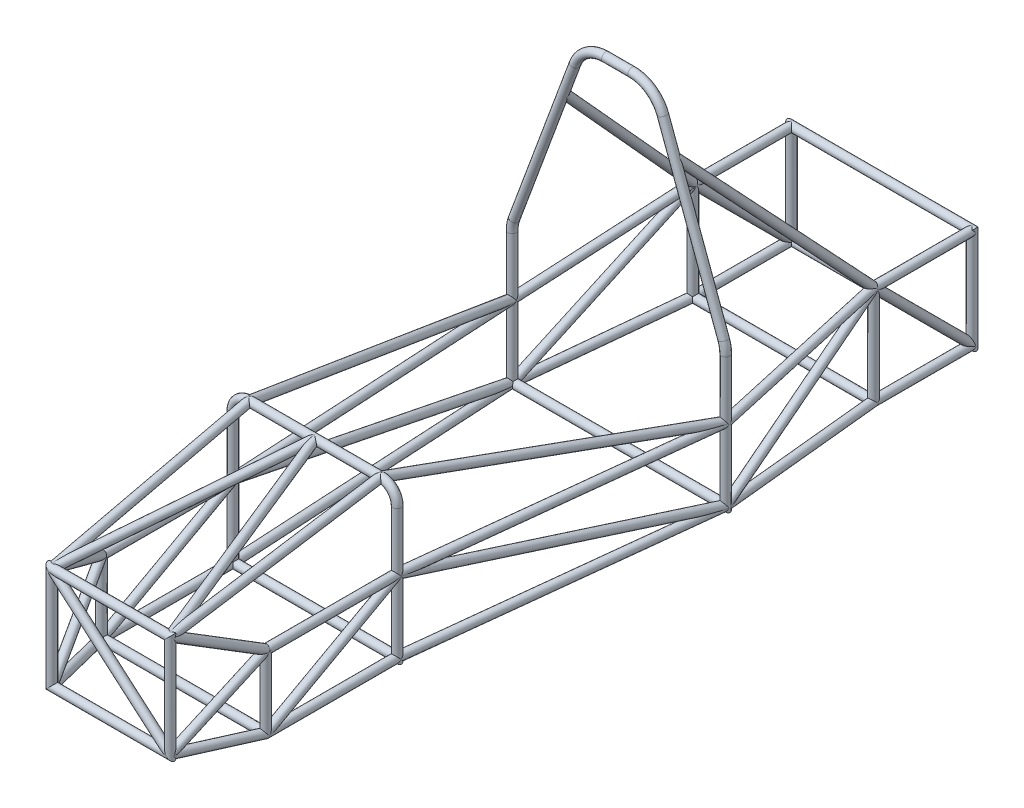
from build123d import *

# Parameters (mm, degrees)
SKETCH13_R                             = 12.7
SKETCH13_R_2                           = 10.3
PIPE_MAIN_HOOP_1_DEPTH                 = 418.960512242
SKETCH13_ON_SEGMENT_2_R                = 12.7
SKETCH13_ON_SEGMENT_2_R_2              = 10.3
PIPE_MAIN_HOOP_1_2_DEPTH               = 687.921024484
SKETCH13_ON_SEGMENT_3_R                = 12.7
SKETCH13_ON_SEGMENT_3_R_2              = 10.3
PIPE_MAIN_HOOP_1_3_DEPTH               = 418.960512242
SKETCH13_ON_SEGMENT_4_R                = 12.7
SKETCH13_ON_SEGMENT_4_R_2              = 10.3
PIPE_MAIN_HOOP_1_4_ANGLE               = 20.30447371
SKETCH13_ON_SEGMENT_5_R                = 12.7
SKETCH13_ON_SEGMENT_5_R_2              = 10.3
PIPE_MAIN_HOOP_1_5_DEPTH               = 533.127564472
SKETCH13_ON_SEGMENT_6_R                = 12.7
SKETCH13_ON_SEGMENT_6_R_2              = 10.3
PIPE_MAIN_HOOP_1_6_ANGLE               = 69.69552629
SKETCH13_ON_SEGMENT_7_R                = 12.7
SKETCH13_ON_SEGMENT_7_R_2              = 10.3
PIPE_MAIN_HOOP_1_7_DEPTH               = 80
SKETCH13_ON_SEGMENT_8_R                = 12.7
SKETCH13_ON_SEGMENT_8_R_2              = 10.3
PIPE_MAIN_HOOP_1_8_ANGLE               = 69.69552629
SKETCH13_ON_SEGMENT_9_R                = 12.7
SKETCH13_ON_SEGMENT_9_R_2              = 10.3
PIPE_MAIN_HOOP_1_9_DEPTH               = 533.127564472
SKETCH13_ON_SEGMENT_10_R               = 12.7
SKETCH13_ON_SEGMENT_10_R_2             = 10.3
PIPE_MAIN_HOOP_1_10_ANGLE              = 20.30447371
PIPE_MAIN_HOOP_2_DEPTH                 = 400
PIPE_MAIN_HOOP_2_DEPTH_BACK            = 18.960512242
SKETCH14_R                             = 12.7
SKETCH14_R_2                           = 10.3
SKETCH14_ON_SEGMENT_2_R                = 12.7
SKETCH14_ON_SEGMENT_2_R_2              = 10.3
PIPE_MAIN_HOOP_2_2_ANGLE               = 90
SKETCH14_ON_SEGMENT_3_R                = 12.7
SKETCH14_ON_SEGMENT_3_R_2              = 10.3
PIPE_MAIN_HOOP_2_3_DEPTH               = 400
SKETCH14_ON_SEGMENT_4_R                = 12.7
SKETCH14_ON_SEGMENT_4_R_2              = 10.3
PIPE_MAIN_HOOP_2_4_ANGLE               = 90
SKETCH14_ON_SEGMENT_5_R                = 12.7
SKETCH14_ON_SEGMENT_5_R_2              = 10.3
PIPE_MAIN_HOOP_2_5_DEPTH               = 418.960512242
SKETCH14_ON_SEGMENT_6_R                = 12.7
SKETCH14_ON_SEGMENT_6_R_2              = 10.3
PIPE_MAIN_HOOP_2_6_DEPTH               = 537.921024484
PIPE_SECONDARY_PROFILE_1_DEPTH         = 328.960512242
PIPE_SECONDARY_PROFILE_1_DEPTH_BACK    = 18.960512242
SKETCH16_R                             = 12.7
SKETCH16_R_2                           = 11.05
SKETCH16_ON_SEGMENT_2_R                = 12.7
SKETCH16_ON_SEGMENT_2_R_2              = 11.05
PIPE_SECONDARY_PROFILE_1_2_DEPTH       = 397.921024484
SKETCH16_ON_SEGMENT_3_R                = 12.7
SKETCH16_ON_SEGMENT_3_R_2              = 11.05
PIPE_SECONDARY_PROFILE_1_3_DEPTH       = 347.921024484
SKETCH16_ON_SEGMENT_4_R                = 12.7
SKETCH16_ON_SEGMENT_4_R_2              = 11.05
PIPE_SECONDARY_PROFILE_1_4_DEPTH       = 397.921024484
SKETCH17_R                             = 12.7
SKETCH17_R_2                           = 11.05
PIPE_SECONDARY_PROFILE_2_DEPTH         = 905.538513814
SKETCH17_ON_SEGMENT_2_R                = 12.7
SKETCH17_ON_SEGMENT_2_R_2              = 11.05
PIPE_SECONDARY_PROFILE_2_2_DEPTH       = 905.538513814
SKETCH18_R                             = 12.7
SKETCH18_R_2                           = 11.05
PIPE_SECONDARY_PROFILE_3_DEPTH         = 931.879820578
SKETCH19_R                             = 12.7
SKETCH19_R_2                           = 11.05
PIPE_SECONDARY_PROFILE_4_DEPTH         = 901.387818866
SKETCH19_ON_SEGMENT_2_R                = 12.7
SKETCH19_ON_SEGMENT_2_R_2              = 11.05
PIPE_SECONDARY_PROFILE_4_2_DEPTH       = 901.387818866
SKETCH110_R                            = 12.7
SKETCH110_R_2                          = 11.05
PIPE_SECONDARY_PROFILE_5_DEPTH         = 927.846970141
SKETCH112_R                            = 12.7
SKETCH112_R_2                          = 11.5
PIPE_TERTIARY_PROFILE_1_DEPTH          = 688.812020801
SKETCH112_ON_SEGMENT_2_R               = 12.7
SKETCH112_ON_SEGMENT_2_R_2             = 11.5
PIPE_TERTIARY_PROFILE_1_2_DEPTH        = 673.484966425
SKETCH114_R                            = 12.7
SKETCH114_R_2                          = 11.05
PIPE_SECONDARY_PROFILE_6_DEPTH         = 661.275109532
SKETCH114_ON_SEGMENT_2_R               = 12.7
SKETCH114_ON_SEGMENT_2_R_2             = 11.05
PIPE_SECONDARY_PROFILE_6_2_DEPTH       = 945.831277028
SKETCH115_R                            = 12.7
SKETCH115_R_2                          = 11.05
PIPE_SECONDARY_PROFILE_7_DEPTH         = 662.70396213
SKETCH115_ON_SEGMENT_2_R               = 12.7
SKETCH115_ON_SEGMENT_2_R_2             = 11.05
PIPE_SECONDARY_PROFILE_7_2_DEPTH       = 938.829504651
SKETCH116_R                            = 12.7
SKETCH116_R_2                          = 11.05
PIPE_SECONDARY_PROFILE_8_DEPTH         = 261.29359767
SKETCH116_ON_SEGMENT_2_R               = 12.7
SKETCH116_ON_SEGMENT_2_R_2             = 11.05
PIPE_SECONDARY_PROFILE_8_2_DEPTH       = 403.258716307
SKETCH117_ON_SEGMENT_1_R               = 12.7
SKETCH117_ON_SEGMENT_1_R_2             = 11.05
PIPE_SECONDARY_PROFILE_10_DEPTH        = 404.791138609
PIPE_SECONDARY_PROFILE_10_2_DEPTH      = 273.316666159
PIPE_SECONDARY_PROFILE_10_2_DEPTH_BACK = 4.791138609
SKETCH117_R                            = 12.7
SKETCH117_R_2                          = 11.05
SKETCH118_R                            = 12.7
SKETCH118_R_2                          = 11.05
PIPE_SECONDARY_PROFILE_11_DEPTH        = 325.89727493
SKETCH118_ON_SEGMENT_2_R               = 12.7
SKETCH118_ON_SEGMENT_2_R_2             = 11.05
PIPE_SECONDARY_PROFILE_11_2_DEPTH      = 407.24072
SKETCH119_ON_SEGMENT_1_R               = 12.7
SKETCH119_ON_SEGMENT_1_R_2             = 11.05
PIPE_SECONDARY_PROFILE_12_DEPTH        = 406.683960994
PIPE_SECONDARY_PROFILE_12_2_DEPTH      = 305.650126779
PIPE_SECONDARY_PROFILE_12_2_DEPTH_BACK = 6.683960994
SKETCH119_R                            = 12.7
SKETCH119_R_2                          = 11.05
SKETCH121_R                            = 12.7
SKETCH121_R_2                          = 11.5
PIPE_TERTIARY_PROFILE_3_DEPTH          = 475.078940809
SKETCH124_R                            = 12.7
SKETCH124_R_2                          = 11.05
PIPE_SECONDARY_PROFILE_14_DEPTH        = 500
SKETCH126_R                            = 12.7
SKETCH126_R_2                          = 11.5
PIPE_TERTIARY_PROFILE_4_DEPTH          = 456.508488421
SKETCH127_R                            = 12.7
SKETCH127_R_2                          = 11.5
PIPE_TERTIARY_PROFILE_5_DEPTH          = 456.508488421
SKETCH129_R                            = 12.7
SKETCH129_R_2                          = 11.05
PIPE_SECONDARY_PROFILE_15_DEPTH        = 231.933823609
SKETCH129_ON_SEGMENT_2_R               = 12.7
SKETCH129_ON_SEGMENT_2_R_2             = 11.05
PIPE_SECONDARY_PROFILE_15_2_DEPTH      = 314.625085458
SKETCH130_R                            = 12.7
SKETCH130_R_2                          = 11.05
PIPE_SECONDARY_PROFILE_16_DEPTH        = 231.63191628
SKETCH130_ON_SEGMENT_2_R               = 12.7
SKETCH130_ON_SEGMENT_2_R_2             = 11.05
PIPE_SECONDARY_PROFILE_16_2_DEPTH      = 300.599042438
PIPE_SECONDARY_PROFILE_20_DEPTH        = 568.960512242
PIPE_SECONDARY_PROFILE_20_DEPTH_BACK   = 18.960512242
SKETCH135_R                            = 12.7
SKETCH135_R_2                          = 11.05
SKETCH135_ON_SEGMENT_2_R               = 12.7
SKETCH135_ON_SEGMENT_2_R_2             = 11.05
PIPE_SECONDARY_PROFILE_20_2_DEPTH      = 337.921024484
SKETCH135_ON_SEGMENT_3_R               = 12.7
SKETCH135_ON_SEGMENT_3_R_2             = 11.05
PIPE_SECONDARY_PROFILE_20_3_DEPTH      = 587.921024484
SKETCH135_ON_SEGMENT_4_R               = 12.7
SKETCH135_ON_SEGMENT_4_R_2             = 11.05
PIPE_SECONDARY_PROFILE_20_4_DEPTH      = 337.921024484
SKETCH136_ON_SEGMENT_1_R               = 12.7
SKETCH136_ON_SEGMENT_1_R_2             = 11.05
PIPE_SECONDARY_PROFILE_21_DEPTH        = 301.895791704
PIPE_SECONDARY_PROFILE_21_2_DEPTH      = 502.493781056
PIPE_SECONDARY_PROFILE_21_2_DEPTH_BACK = 1.895791704
SKETCH136_R                            = 12.7
SKETCH136_R_2                          = 11.05
SKETCH137_R                            = 12.7
SKETCH137_R_2                          = 11.05
PIPE_SECONDARY_PROFILE_22_DEPTH        = 504.38957276
SKETCH137_ON_SEGMENT_2_R               = 12.7
SKETCH137_ON_SEGMENT_2_R_2             = 11.05
PIPE_SECONDARY_PROFILE_22_2_DEPTH      = 301.895791704
SKETCH138_R                            = 12.7
SKETCH138_R_2                          = 11.05
PIPE_SECONDARY_PROFILE_23_DEPTH        = 511.50174318
SKETCH138_ON_SEGMENT_2_R               = 12.7
SKETCH138_ON_SEGMENT_2_R_2             = 11.05
PIPE_SECONDARY_PROFILE_23_2_DEPTH      = 302.679573851
SKETCH139_R                            = 12.7
SKETCH139_R_2                          = 11.05
PIPE_SECONDARY_PROFILE_24_DEPTH        = 511.50174318
SKETCH139_ON_SEGMENT_2_R               = 12.7
SKETCH139_ON_SEGMENT_2_R_2             = 11.05
PIPE_SECONDARY_PROFILE_24_2_DEPTH      = 302.679573851
SKETCH140_R                            = 12.7
SKETCH140_R_2                          = 11.05
PIPE_SECONDARY_PROFILE_25_DEPTH        = 300
SKETCH141_R                            = 12.7
SKETCH141_R_2                          = 11.05
PIPE_SECONDARY_PROFILE_26_DEPTH        = 300
SKETCH142_R                            = 12.7
SKETCH142_R_2                          = 11.05
PIPE_SECONDARY_PROFILE_27_DEPTH        = 743.554316585
SKETCH143_R                            = 12.7
SKETCH143_R_2                          = 11.05
PIPE_SECONDARY_PROFILE_28_DEPTH        = 743.554316585
SKETCH144_R                            = 12.7
SKETCH144_R_2                          = 11.05
PIPE_SECONDARY_PROFILE_29_DEPTH        = 550
SKETCH145_R                            = 12.7
SKETCH145_R_2                          = 11.05
PIPE_SECONDARY_PROFILE_30_DEPTH        = 424.264068712
SKETCH146_R                            = 12.7
SKETCH146_R_2                          = 11.05
PIPE_SECONDARY_PROFILE_31_DEPTH        = 585.234995536
SKETCH147_R                            = 12.7
SKETCH147_R_2                          = 11.05
PIPE_SECONDARY_PROFILE_32_DEPTH        = 424.264068712
SKETCH148_R                            = 12.7
SKETCH148_R_2                          = 11.05
PIPE_SECONDARY_PROFILE_33_DEPTH        = 585.234995536


with BuildPart() as part:
    # Sketch13 → Pipe MAIN HOOP(1) (new body)
    with BuildSketch(Plane(origin=(650, 400, 0), x_dir=(1, 0, 0), z_dir=(0, -1, 0))):
        Circle(SKETCH13_R)
        Circle(SKETCH13_R_2, mode=Mode.SUBTRACT)
    extrude(amount=PIPE_MAIN_HOOP_1_DEPTH)

    # Pipe MAIN HOOP(1) mitre 1
    split(bisect_by=Plane(origin=(650, 0, 0), x_dir=(-0.707106781, 0.707106781, 0), z_dir=(0.707106781, 0.707106781, 0)), keep=Keep.TOP)


with BuildPart() as body_2:
    # Sketch13 on segment 2 (carried to segment 2) → Pipe MAIN HOOP_1 2 (new body)
    with BuildSketch(Plane(origin=(668.960512242, 0, 0), x_dir=(0, -1, 0), z_dir=(-1, 0, 0))):
        Circle(SKETCH13_ON_SEGMENT_2_R)
        Circle(SKETCH13_ON_SEGMENT_2_R_2, mode=Mode.SUBTRACT)
    extrude(amount=PIPE_MAIN_HOOP_1_2_DEPTH)

    # Pipe MAIN HOOP_1 2 mitre 1
    split(bisect_by=Plane(origin=(650, 0, 0), x_dir=(0.707106781, -0.707106781, 0), z_dir=(-0.707106781, -0.707106781, 0)), keep=Keep.TOP)

    # Pipe MAIN HOOP_1 2 mitre 2
    split(bisect_by=Plane(origin=(0, 0, 0), x_dir=(0.707106781, 0.707106781, 0), z_dir=(0.707106781, -0.707106781, 0)), keep=Keep.TOP)


with BuildPart() as body_3:
    # Sketch13 on segment 3 (carried to segment 3) → Pipe MAIN HOOP_1 3 (new body)
    with BuildSketch(Plane(origin=(0, -18.960512242, 0), x_dir=(-1, 0, 0), z_dir=(0, 1, 0))):
        Circle(SKETCH13_ON_SEGMENT_3_R)
        Circle(SKETCH13_ON_SEGMENT_3_R_2, mode=Mode.SUBTRACT)
    extrude(amount=PIPE_MAIN_HOOP_1_3_DEPTH)

    # Pipe MAIN HOOP_1 3 mitre 1
    split(bisect_by=Plane(origin=(0, 0, 0), x_dir=(-0.707106781, -0.707106781, 0), z_dir=(-0.707106781, 0.707106781, 0)), keep=Keep.TOP)


with BuildPart() as body_4:
    # Sketch13 on segment 4 (carried to the start of arc 4) → Pipe MAIN HOOP_1 4 (revolve)
    with BuildSketch(Plane(origin=(0, 400, 0), x_dir=(-1, 0, 0), z_dir=(0, 1, 0))):
        Circle(SKETCH13_ON_SEGMENT_4_R)
        Circle(SKETCH13_ON_SEGMENT_4_R_2, mode=Mode.SUBTRACT)
    revolve(axis=Axis((100, 400, 0), (0, 0, -1)), revolution_arc=PIPE_MAIN_HOOP_1_4_ANGLE)


with BuildPart() as body_5:
    # Sketch13 on segment 5 (carried to segment 5) → Pipe MAIN HOOP_1 5 (new body)
    with BuildSketch(Plane(origin=(6.213815732, 434.700888179, 0), x_dir=(-0.937861843, 0.347008882, 0), z_dir=(0.347008882, 0.937861843, 0))):
        Circle(SKETCH13_ON_SEGMENT_5_R)
        Circle(SKETCH13_ON_SEGMENT_5_R_2, mode=Mode.SUBTRACT)
    extrude(amount=PIPE_MAIN_HOOP_1_5_DEPTH)


with BuildPart() as body_6:
    # Sketch13 on segment 6 (carried to the start of arc 6) → Pipe MAIN HOOP_1 6 (revolve)
    with BuildSketch(Plane(origin=(191.213815732, 934.700888179, 0), x_dir=(-0.937861843, 0.347008882, 0), z_dir=(0.347008882, 0.937861843, 0))):
        Circle(SKETCH13_ON_SEGMENT_6_R)
        Circle(SKETCH13_ON_SEGMENT_6_R_2, mode=Mode.SUBTRACT)
    revolve(axis=Axis((285, 900, 0), (0, 0, -1)), revolution_arc=PIPE_MAIN_HOOP_1_6_ANGLE)


with BuildPart() as body_7:
    # Sketch13 on segment 7 (carried to segment 7) → Pipe MAIN HOOP_1 7 (new body)
    with BuildSketch(Plane(origin=(285, 1000, 0), x_dir=(0, 1, 0), z_dir=(1, 0, 0))):
        Circle(SKETCH13_ON_SEGMENT_7_R)
        Circle(SKETCH13_ON_SEGMENT_7_R_2, mode=Mode.SUBTRACT)
    extrude(amount=PIPE_MAIN_HOOP_1_7_DEPTH)


with BuildPart() as body_8:
    # Sketch13 on segment 8 (carried to the start of arc 8) → Pipe MAIN HOOP_1 8 (revolve)
    with BuildSketch(Plane(origin=(365, 1000, 0), x_dir=(0, 1, 0), z_dir=(1, 0, 0))):
        Circle(SKETCH13_ON_SEGMENT_8_R)
        Circle(SKETCH13_ON_SEGMENT_8_R_2, mode=Mode.SUBTRACT)
    revolve(axis=Axis((365, 900, 0), (0, 0, -1)), revolution_arc=PIPE_MAIN_HOOP_1_8_ANGLE)


with BuildPart() as body_9:
    # Sketch13 on segment 9 (carried to segment 9) → Pipe MAIN HOOP_1 9 (new body)
    with BuildSketch(Plane(origin=(458.786184268, 934.700888179, 0), x_dir=(0.937861843, 0.347008882, 0), z_dir=(0.347008882, -0.937861843, 0))):
        Circle(SKETCH13_ON_SEGMENT_9_R)
        Circle(SKETCH13_ON_SEGMENT_9_R_2, mode=Mode.SUBTRACT)
    extrude(amount=PIPE_MAIN_HOOP_1_9_DEPTH)


with BuildPart() as body_10:
    # Sketch13 on segment 10 (carried to the start of arc 10) → Pipe MAIN HOOP_1 10 (revolve)
    with BuildSketch(Plane(origin=(643.786184268, 434.700888179, 0), x_dir=(0.937861843, 0.347008882, 0), z_dir=(0.347008882, -0.937861843, 0))):
        Circle(SKETCH13_ON_SEGMENT_10_R)
        Circle(SKETCH13_ON_SEGMENT_10_R_2, mode=Mode.SUBTRACT)
    revolve(axis=Axis((550, 400, 0), (0, 0, -1)), revolution_arc=PIPE_MAIN_HOOP_1_10_ANGLE)


with BuildPart() as body_11:
    # Sketch14 → Pipe MAIN HOOP(2) (new, two sides: drawn at the far end of the back side and taken through both)
    with BuildSketch(Plane(origin=(550, 0, 900), x_dir=(-1, 0, 0), z_dir=(0, 1, 0)).offset(-PIPE_MAIN_HOOP_2_DEPTH_BACK)):
        Circle(SKETCH14_R)
        Circle(SKETCH14_R_2, mode=Mode.SUBTRACT)
    extrude(amount=PIPE_MAIN_HOOP_2_DEPTH + PIPE_MAIN_HOOP_2_DEPTH_BACK)

    # Pipe MAIN HOOP(2) mitre 1
    split(bisect_by=Plane(origin=(550, 0, 900), x_dir=(-0.707106781, 0.707106781, 0), z_dir=(0.707106781, 0.707106781, 0)), keep=Keep.TOP)


with BuildPart() as body_12:
    # Sketch14 on segment 2 (carried to the start of arc 2) → Pipe MAIN HOOP_2 2 (revolve)
    with BuildSketch(Plane(origin=(550, 400, 900), x_dir=(-1, 0, 0), z_dir=(0, 1, 0))):
        Circle(SKETCH14_ON_SEGMENT_2_R)
        Circle(SKETCH14_ON_SEGMENT_2_R_2, mode=Mode.SUBTRACT)
    revolve(axis=Axis((500, 400, 900), (0, 0, 1)), revolution_arc=PIPE_MAIN_HOOP_2_2_ANGLE)


with BuildPart() as body_13:
    # Sketch14 on segment 3 (carried to segment 3) → Pipe MAIN HOOP_2 3 (new body)
    with BuildSketch(Plane(origin=(500, 450, 900), x_dir=(0, -1, 0), z_dir=(-1, 0, 0))):
        Circle(SKETCH14_ON_SEGMENT_3_R)
        Circle(SKETCH14_ON_SEGMENT_3_R_2, mode=Mode.SUBTRACT)
    extrude(amount=PIPE_MAIN_HOOP_2_3_DEPTH)


with BuildPart() as body_14:
    # Sketch14 on segment 4 (carried to the start of arc 4) → Pipe MAIN HOOP_2 4 (revolve)
    with BuildSketch(Plane(origin=(100, 450, 900), x_dir=(0, -1, 0), z_dir=(-1, 0, 0))):
        Circle(SKETCH14_ON_SEGMENT_4_R)
        Circle(SKETCH14_ON_SEGMENT_4_R_2, mode=Mode.SUBTRACT)
    revolve(axis=Axis((100, 400, 900), (0, 0, 1)), revolution_arc=PIPE_MAIN_HOOP_2_4_ANGLE)


with BuildPart() as body_15:
    # Sketch14 on segment 5 (carried to segment 5) → Pipe MAIN HOOP_2 5 (new body)
    with BuildSketch(Plane(origin=(50, 400, 900), x_dir=(1, 0, 0), z_dir=(0, -1, 0))):
        Circle(SKETCH14_ON_SEGMENT_5_R)
        Circle(SKETCH14_ON_SEGMENT_5_R_2, mode=Mode.SUBTRACT)
    extrude(amount=PIPE_MAIN_HOOP_2_5_DEPTH)

    # Pipe MAIN HOOP_2 5 mitre 1
    split(bisect_by=Plane(origin=(50, 0, 900), x_dir=(-0.707106781, -0.707106781, 0), z_dir=(-0.707106781, 0.707106781, 0)), keep=Keep.TOP)


with BuildPart() as body_16:
    # Sketch14 on segment 6 (carried to segment 6) → Pipe MAIN HOOP_2 6 (new body)
    with BuildSketch(Plane(origin=(31.039487758, 0, 900), x_dir=(0, 1, 0), z_dir=(1, 0, 0))):
        Circle(SKETCH14_ON_SEGMENT_6_R)
        Circle(SKETCH14_ON_SEGMENT_6_R_2, mode=Mode.SUBTRACT)
    extrude(amount=PIPE_MAIN_HOOP_2_6_DEPTH)

    # Pipe MAIN HOOP_2 6 mitre 1
    split(bisect_by=Plane(origin=(50, 0, 900), x_dir=(0.707106781, 0.707106781, 0), z_dir=(0.707106781, -0.707106781, 0)), keep=Keep.TOP)

    # Pipe MAIN HOOP_2 6 mitre 2
    split(bisect_by=Plane(origin=(550, 0, 900), x_dir=(0.707106781, -0.707106781, 0), z_dir=(-0.707106781, -0.707106781, 0)), keep=Keep.TOP)


with BuildPart() as body_17:
    # Sketch16 → Pipe SECONDARY PROFILE(1) (new, two sides: drawn at the far end of the back side and taken through both)
    with BuildSketch(Plane(origin=(509, 49, 1550), x_dir=(-1, 0, 0), z_dir=(0, 1, 0)).offset(-PIPE_SECONDARY_PROFILE_1_DEPTH_BACK)):
        Circle(SKETCH16_R)
        Circle(SKETCH16_R_2, mode=Mode.SUBTRACT)
    extrude(amount=PIPE_SECONDARY_PROFILE_1_DEPTH + PIPE_SECONDARY_PROFILE_1_DEPTH_BACK)

    # Pipe SECONDARY PROFILE(1) mitre 1
    split(bisect_by=Plane(origin=(509, 49, 1550), x_dir=(-0.707106781, 0.707106781, 0), z_dir=(0.707106781, 0.707106781, 0)), keep=Keep.TOP)

    # Pipe SECONDARY PROFILE(1) mitre 2
    split(bisect_by=Plane(origin=(509, 359, 1550), x_dir=(0.707106781, 0.707106781, 0), z_dir=(0.707106781, -0.707106781, 0)), keep=Keep.TOP)


with BuildPart() as body_18:
    # Sketch16 on segment 2 (carried to segment 2) → Pipe SECONDARY PROFILE_1 2 (new body)
    with BuildSketch(Plane(origin=(527.960512242, 359, 1550), x_dir=(0, -1, 0), z_dir=(-1, 0, 0))):
        Circle(SKETCH16_ON_SEGMENT_2_R)
        Circle(SKETCH16_ON_SEGMENT_2_R_2, mode=Mode.SUBTRACT)
    extrude(amount=PIPE_SECONDARY_PROFILE_1_2_DEPTH)

    # Pipe SECONDARY PROFILE_1 2 mitre 1
    split(bisect_by=Plane(origin=(509, 359, 1550), x_dir=(-0.707106781, -0.707106781, 0), z_dir=(-0.707106781, 0.707106781, 0)), keep=Keep.TOP)

    # Pipe SECONDARY PROFILE_1 2 mitre 2
    split(bisect_by=Plane(origin=(149, 359, 1550), x_dir=(-0.707106781, 0.707106781, 0), z_dir=(0.707106781, 0.707106781, 0)), keep=Keep.TOP)


with BuildPart() as body_19:
    # Sketch16 on segment 3 (carried to segment 3) → Pipe SECONDARY PROFILE_1 3 (new body)
    with BuildSketch(Plane(origin=(149, 377.960512242, 1550), x_dir=(1, 0, 0), z_dir=(0, -1, 0))):
        Circle(SKETCH16_ON_SEGMENT_3_R)
        Circle(SKETCH16_ON_SEGMENT_3_R_2, mode=Mode.SUBTRACT)
    extrude(amount=PIPE_SECONDARY_PROFILE_1_3_DEPTH)

    # Pipe SECONDARY PROFILE_1 3 mitre 1
    split(bisect_by=Plane(origin=(149, 359, 1550), x_dir=(0.707106781, -0.707106781, 0), z_dir=(-0.707106781, -0.707106781, 0)), keep=Keep.TOP)

    # Pipe SECONDARY PROFILE_1 3 mitre 2
    split(bisect_by=Plane(origin=(149, 49, 1550), x_dir=(-0.707106781, -0.707106781, 0), z_dir=(-0.707106781, 0.707106781, 0)), keep=Keep.TOP)


with BuildPart() as body_20:
    # Sketch16 on segment 4 (carried to segment 4) → Pipe SECONDARY PROFILE_1 4 (new body)
    with BuildSketch(Plane(origin=(130.039487758, 49, 1550), x_dir=(0, 1, 0), z_dir=(1, 0, 0))):
        Circle(SKETCH16_ON_SEGMENT_4_R)
        Circle(SKETCH16_ON_SEGMENT_4_R_2, mode=Mode.SUBTRACT)
    extrude(amount=PIPE_SECONDARY_PROFILE_1_4_DEPTH)

    # Pipe SECONDARY PROFILE_1 4 mitre 1
    split(bisect_by=Plane(origin=(149, 49, 1550), x_dir=(0.707106781, 0.707106781, 0), z_dir=(0.707106781, -0.707106781, 0)), keep=Keep.TOP)

    # Pipe SECONDARY PROFILE_1 4 mitre 2
    split(bisect_by=Plane(origin=(509, 49, 1550), x_dir=(0.707106781, -0.707106781, 0), z_dir=(-0.707106781, -0.707106781, 0)), keep=Keep.TOP)


with BuildPart() as body_21:
    # Sketch17 → Pipe SECONDARY PROFILE(2) (new body)
    with BuildSketch(Plane(origin=(650, 220, 0), x_dir=(0.9938837346736189, 0, 0.11043152607484652), z_dir=(-0.11043152607484652, 0, 0.9938837346736189))):
        Circle(SKETCH17_R)
        Circle(SKETCH17_R_2, mode=Mode.SUBTRACT)
    extrude(amount=PIPE_SECONDARY_PROFILE_2_DEPTH)


with BuildPart() as body_22:
    # Sketch17 on segment 2 (carried to segment 2) → Pipe SECONDARY PROFILE_2 2 (new body)
    with BuildSketch(Plane(origin=(650, 0, 0), x_dir=(0.993883735, 0, 0.110431526), z_dir=(-0.110431526, 0, 0.993883735))):
        Circle(SKETCH17_ON_SEGMENT_2_R)
        Circle(SKETCH17_ON_SEGMENT_2_R_2, mode=Mode.SUBTRACT)
    extrude(amount=PIPE_SECONDARY_PROFILE_2_2_DEPTH)


with BuildPart() as body_23:
    # Sketch18 → Pipe SECONDARY PROFILE(3) (new body)
    with BuildSketch(Plane(origin=(550, 220, 900), x_dir=(0.663392162227186, 0.7405372431001913, -0.10730997473258166), z_dir=(0.10730997473258165, -0.23608194441167973, -0.9657897725932354))):
        Circle(SKETCH18_R)
        Circle(SKETCH18_R_2, mode=Mode.SUBTRACT)
    extrude(amount=PIPE_SECONDARY_PROFILE_3_DEPTH)


with BuildPart() as body_24:
    # Sketch19 → Pipe SECONDARY PROFILE(4) (new body)
    with BuildSketch(Plane(origin=(0, 0, 0), x_dir=(0.9984603532054125, 0, -0.05547001962252292), z_dir=(0.05547001962252292, 0, 0.9984603532054125))):
        Circle(SKETCH19_R)
        Circle(SKETCH19_R_2, mode=Mode.SUBTRACT)
    extrude(amount=PIPE_SECONDARY_PROFILE_4_DEPTH)


with BuildPart() as body_25:
    # Sketch19 on segment 2 (carried to segment 2) → Pipe SECONDARY PROFILE_4 2 (new body)
    with BuildSketch(Plane(origin=(0, 220, 0), x_dir=(0.998460353, 0, -0.05547002), z_dir=(0.05547002, 0, 0.998460353))):
        Circle(SKETCH19_ON_SEGMENT_2_R)
        Circle(SKETCH19_ON_SEGMENT_2_R_2, mode=Mode.SUBTRACT)
    extrude(amount=PIPE_SECONDARY_PROFILE_4_2_DEPTH)


with BuildPart() as body_26:
    # Sketch110 → Pipe SECONDARY PROFILE(5) (new body)
    with BuildSketch(Plane(origin=(50, 220, 900), x_dir=(0.9032422622823457, -0.4257340459576792, 0.05388819666285798), z_dir=(-0.05388819666285808, -0.23710806531657555, -0.9699875399314445))):
        Circle(SKETCH110_R)
        Circle(SKETCH110_R_2, mode=Mode.SUBTRACT)
    extrude(amount=PIPE_SECONDARY_PROFILE_5_DEPTH)


with BuildPart() as body_27:
    # Sketch112 → Pipe TERTIARY PROFILE(1) (new body)
    with BuildSketch(Plane(origin=(509, 359, 1550), x_dir=(-0.6339004754744642, 0.7114112118094557, 0.30342095330588226), z_dir=(-0.30342095330588215, 0.13211151555423584, -0.9436536825302556))):
        Circle(SKETCH112_R)
        Circle(SKETCH112_R_2, mode=Mode.SUBTRACT)
    extrude(amount=PIPE_TERTIARY_PROFILE_1_DEPTH)


with BuildPart() as body_28:
    # Sketch112 on segment 2 (carried to segment 2) → Pipe TERTIARY PROFILE_1 2 (new body)
    with BuildSketch(Plane(origin=(300, 450, 900), x_dir=(0.648326673, 0.7187177, 0.251231751), z_dir=(-0.224206935, -0.135118087, 0.96512919))):
        Circle(SKETCH112_ON_SEGMENT_2_R)
        Circle(SKETCH112_ON_SEGMENT_2_R_2, mode=Mode.SUBTRACT)
    extrude(amount=PIPE_TERTIARY_PROFILE_1_2_DEPTH)


with BuildPart() as body_29:
    # Sketch114 → Pipe SECONDARY PROFILE(6) (new body)
    with BuildSketch(Plane(origin=(509, 359, 1550), x_dir=(0.9807211025047194, 0.1949310746745047, 0.013711135188980707), z_dir=(-0.013711135188980678, 0.13863481135524922, -0.9902486525374948))):
        Circle(SKETCH114_R)
        Circle(SKETCH114_R_2, mode=Mode.SUBTRACT)
    extrude(amount=PIPE_SECONDARY_PROFILE_6_DEPTH)

    # Pipe SECONDARY PROFILE(6) mitre 1
    split(bisect_by=Plane(origin=(500, 450, 900), x_dir=(0, -0.998526501, 0.054266259), z_dir=(-0.074526196, 0.054115348, 0.995749655)), keep=Keep.TOP)


with BuildPart() as body_30:
    # Sketch114 on segment 2 (carried to segment 2) → Pipe SECONDARY PROFILE_6 2 (new body)
    with BuildSketch(Plane(origin=(499.222974449, 451.191439178, 904.662153305), x_dir=(0.97343426, 0.200222234, 0.111071139), z_dir=(0.15941218, -0.244432009, -0.956473079))):
        Circle(SKETCH114_ON_SEGMENT_2_R)
        Circle(SKETCH114_ON_SEGMENT_2_R_2, mode=Mode.SUBTRACT)
    extrude(amount=PIPE_SECONDARY_PROFILE_6_2_DEPTH)

    # Pipe SECONDARY PROFILE_6 2 mitre 1
    split(bisect_by=Plane(origin=(500, 450, 900), x_dir=(0, 0.998526501, -0.054266259), z_dir=(0.074526196, -0.054115348, -0.995749655)), keep=Keep.TOP)


with BuildPart() as body_31:
    # Sketch115 → Pipe SECONDARY PROFILE(7) (new body)
    with BuildSketch(Plane(origin=(149, 359, 1550), x_dir=(0.5532473669682797, 0.8296834613446238, 0.07444934461679241), z_dir=(-0.07444934461679237, 0.13826306857404308, -0.9875933469574507))):
        Circle(SKETCH115_R)
        Circle(SKETCH115_R_2, mode=Mode.SUBTRACT)
    extrude(amount=PIPE_SECONDARY_PROFILE_7_DEPTH)

    # Pipe SECONDARY PROFILE(7) mitre 1
    split(bisect_by=Plane(origin=(100, 450, 900), x_dir=(0, -0.998473645, 0.05523024), z_dir=(0.092485312, 0.054993526, 0.994194236)), keep=Keep.TOP)


with BuildPart() as body_32:
    # Sketch115 on segment 2 (carried to segment 2) → Pipe SECONDARY PROFILE_7 2 (new body)
    with BuildSketch(Plane(origin=(100.485751081, 451.117227486, 904.371759727), x_dir=(0.521652242, 0.810896399, -0.26519044), z_dir=(-0.107033014, -0.246175931, -0.963297122))):
        Circle(SKETCH115_ON_SEGMENT_2_R)
        Circle(SKETCH115_ON_SEGMENT_2_R_2, mode=Mode.SUBTRACT)
    extrude(amount=PIPE_SECONDARY_PROFILE_7_2_DEPTH)

    # Pipe SECONDARY PROFILE_7 2 mitre 1
    split(bisect_by=Plane(origin=(100, 450, 900), x_dir=(0, 0.998473645, -0.05523024), z_dir=(-0.092485312, -0.054993526, -0.994194236)), keep=Keep.TOP)


with BuildPart() as body_33:
    # Sketch116 → Pipe SECONDARY PROFILE(8) (new body)
    with BuildSketch(Plane(origin=(509, 49, 1550), x_dir=(0.18920730616668066, 0.9689961462886005, -0.15889324646123007), z_dir=(0.15889324646123018, -0.189896806746348, -0.9688612589099386))):
        Circle(SKETCH116_R)
        Circle(SKETCH116_R_2, mode=Mode.SUBTRACT)
    extrude(amount=PIPE_SECONDARY_PROFILE_8_DEPTH)

    # Pipe SECONDARY PROFILE(8) mitre 1
    split(bisect_by=Plane(origin=(550, 0, 1300), x_dir=(0, -0.995380894, 0.096004557), z_dir=(-0.080072407, 0.095696291, 0.992184776)), keep=Keep.TOP)


with BuildPart() as body_34:
    # Sketch116 on segment 2 (carried to segment 2) → Pipe SECONDARY PROFILE_8 2 (new body)
    with BuildSketch(Plane(origin=(550, 0, 1303.258716307), x_dir=(0.176384125, 0.984321411, 0), z_dir=(0, 0, -1))):
        Circle(SKETCH116_ON_SEGMENT_2_R)
        Circle(SKETCH116_ON_SEGMENT_2_R_2, mode=Mode.SUBTRACT)
    extrude(amount=PIPE_SECONDARY_PROFILE_8_2_DEPTH)

    # Pipe SECONDARY PROFILE_8 2 mitre 1
    split(bisect_by=Plane(origin=(550, 0, 1300), x_dir=(0, 0.995380894, -0.096004557), z_dir=(0.080072407, -0.095696291, -0.992184776)), keep=Keep.TOP)


with BuildPart() as body_35:
    # Sketch117 on segment 1 (carried to segment 1) → Pipe SECONDARY PROFILE(10) (new body)
    with BuildSketch(Plane(origin=(50, 0, 900), x_dir=(1, 0, 0), z_dir=(0, 0, 1))):
        Circle(SKETCH117_ON_SEGMENT_1_R)
        Circle(SKETCH117_ON_SEGMENT_1_R_2, mode=Mode.SUBTRACT)
    extrude(amount=PIPE_SECONDARY_PROFILE_10_DEPTH)

    # Pipe SECONDARY PROFILE(10) mitre 1
    split(bisect_by=Plane(origin=(50, 0, 1300), x_dir=(0, 0.995644994, -0.093225781), z_dir=(-0.185099334, -0.091614822, -0.978440065)), keep=Keep.TOP)


with BuildPart() as body_36:
    # Sketch117 → Pipe SECONDARY PROFILE_10 2 (new, two sides: drawn at the far end of the back side and taken through both)
    with BuildSketch(Plane(origin=(50, 0, 1300), x_dir=(0.9314764730155183, -0.033915685073127345, -0.3622172090398122), z_dir=(0.3622172090398122, 0.17927922467627078, 0.9146899218177078)).offset(-PIPE_SECONDARY_PROFILE_10_2_DEPTH_BACK)):
        Circle(SKETCH117_R)
        Circle(SKETCH117_R_2, mode=Mode.SUBTRACT)
    extrude(amount=PIPE_SECONDARY_PROFILE_10_2_DEPTH + PIPE_SECONDARY_PROFILE_10_2_DEPTH_BACK)

    # Pipe SECONDARY PROFILE_10 2 mitre 1
    split(bisect_by=Plane(origin=(50, 0, 1300), x_dir=(0, -0.995644994, 0.093225781), z_dir=(0.185099334, 0.091614822, 0.978440065)), keep=Keep.TOP)


with BuildPart() as body_37:
    # Sketch118 → Pipe SECONDARY PROFILE(11) (new body)
    with BuildSketch(Plane(origin=(149, 49, 1550), x_dir=(0.552012882786451, 0.7737959297324939, 0.31067931435359114), z_dir=(-0.3106793143535911, 0.5366279066107483, -0.7845437231151293))):
        Circle(SKETCH118_R)
        Circle(SKETCH118_R_2, mode=Mode.SUBTRACT)
    extrude(amount=PIPE_SECONDARY_PROFILE_11_DEPTH)

    # Pipe SECONDARY PROFILE(11) mitre 1
    split(bisect_by=Plane(origin=(50, 220, 1300), x_dir=(0, -0.957639278, -0.287970507), z_dir=(0.164449949, -0.284049912, 0.94460143)), keep=Keep.TOP)


with BuildPart() as body_38:
    # Sketch118 on segment 2 (carried to segment 2) → Pipe SECONDARY PROFILE_11 2 (new body)
    with BuildSketch(Plane(origin=(50, 220, 1307.24072), x_dir=(0.497925311, 0.867219917, 0), z_dir=(0, 0, -1))):
        Circle(SKETCH118_ON_SEGMENT_2_R)
        Circle(SKETCH118_ON_SEGMENT_2_R_2, mode=Mode.SUBTRACT)
    extrude(amount=PIPE_SECONDARY_PROFILE_11_2_DEPTH)

    # Pipe SECONDARY PROFILE_11 2 mitre 1
    split(bisect_by=Plane(origin=(50, 220, 1300), x_dir=(0, 0.957639278, 0.287970507), z_dir=(-0.164449949, 0.284049912, -0.94460143)), keep=Keep.TOP)


with BuildPart() as body_39:
    # Sketch119 on segment 1 (carried to segment 1) → Pipe SECONDARY PROFILE(12) (new body)
    with BuildSketch(Plane(origin=(550, 220, 900), x_dir=(1, 0, 0), z_dir=(0, 0, 1))):
        Circle(SKETCH119_ON_SEGMENT_1_R)
        Circle(SKETCH119_ON_SEGMENT_1_R_2, mode=Mode.SUBTRACT)
    extrude(amount=PIPE_SECONDARY_PROFILE_12_DEPTH)

    # Pipe SECONDARY PROFILE(12) mitre 1
    split(bisect_by=Plane(origin=(550, 220, 1300), x_dir=(0, 0.95576415, 0.294134135), z_dir=(0.070348665, 0.293405407, -0.953396209)), keep=Keep.TOP)


with BuildPart() as body_40:
    # Sketch119 → Pipe SECONDARY PROFILE_12 2 (new, two sides: drawn at the far end of the back side and taken through both)
    with BuildSketch(Plane(origin=(550, 220, 1300), x_dir=(0.9901021306843453, -0.04128135738968246, 0.13414030097768997), z_dir=(-0.13414030097769, -0.5594632065167063, 0.817928664498109)).offset(-PIPE_SECONDARY_PROFILE_12_2_DEPTH_BACK)):
        Circle(SKETCH119_R)
        Circle(SKETCH119_R_2, mode=Mode.SUBTRACT)
    extrude(amount=PIPE_SECONDARY_PROFILE_12_2_DEPTH + PIPE_SECONDARY_PROFILE_12_2_DEPTH_BACK)

    # Pipe SECONDARY PROFILE_12 2 mitre 1
    split(bisect_by=Plane(origin=(550, 220, 1300), x_dir=(0, -0.95576415, -0.294134135), z_dir=(-0.070348665, -0.293405407, 0.953396209)), keep=Keep.TOP)


with BuildPart() as body_41:
    # Sketch121 → Pipe TERTIARY PROFILE(3) (new body)
    with BuildSketch(Plane(origin=(149, 359, 1550), x_dir=(0.42578644217988465, 0.4944616747895436, -0.757768802353406), z_dir=(0.7577688023534062, -0.6525231353598773, 0))):
        Circle(SKETCH121_R)
        Circle(SKETCH121_R_2, mode=Mode.SUBTRACT)
    extrude(amount=PIPE_TERTIARY_PROFILE_3_DEPTH)


with BuildPart() as body_42:
    # Sketch124 → Pipe SECONDARY PROFILE(14) (new body)
    with BuildSketch(Plane(origin=(50, 0, 1300), x_dir=(0, 0, -1), z_dir=(1, 0, 0))):
        Circle(SKETCH124_R)
        Circle(SKETCH124_R_2, mode=Mode.SUBTRACT)
    extrude(amount=PIPE_SECONDARY_PROFILE_14_DEPTH)


with BuildPart() as body_43:
    # Sketch126 → Pipe TERTIARY PROFILE(4) (new body)
    with BuildSketch(Plane(origin=(550, 220, 900), x_dir=(1, 0, 0), z_dir=(0, -0.4819187497721558, 0.876215908676647))):
        Circle(SKETCH126_R)
        Circle(SKETCH126_R_2, mode=Mode.SUBTRACT)
    extrude(amount=PIPE_TERTIARY_PROFILE_4_DEPTH)


with BuildPart() as body_44:
    # Sketch127 → Pipe TERTIARY PROFILE(5) (new body)
    with BuildSketch(Plane(origin=(50, 0, 1300), x_dir=(1, 0, 0), z_dir=(0, 0.48191874977215604, -0.876215908676647))):
        Circle(SKETCH127_R)
        Circle(SKETCH127_R_2, mode=Mode.SUBTRACT)
    extrude(amount=PIPE_TERTIARY_PROFILE_5_DEPTH)


with BuildPart() as body_45:
    # Sketch129 → Pipe SECONDARY PROFILE(15) (new body)
    with BuildSketch(Plane(origin=(50, 0, 1300), x_dir=(1, 0, 0), z_dir=(0, 1, 0))):
        Circle(SKETCH129_R)
        Circle(SKETCH129_R_2, mode=Mode.SUBTRACT)
    extrude(amount=PIPE_SECONDARY_PROFILE_15_DEPTH)

    # Pipe SECONDARY PROFILE(15) mitre 1
    split(bisect_by=Plane(origin=(50, 220, 1300), x_dir=(0.975789466, -0.21871195, 0), z_dir=(-0.191452416, -0.854170295, -0.483465697)), keep=Keep.TOP)


with BuildPart() as body_46:
    # Sketch129 on segment 2 (carried to segment 2) → Pipe SECONDARY PROFILE_15 2 (new body)
    with BuildSketch(Plane(origin=(46.096852846, 214.519823693, 1290.143567793), x_dir=(0.926691945, -0.327065933, -0.185121351), z_dir=(0.327065933, 0.459213785, 0.825924074))):
        Circle(SKETCH129_ON_SEGMENT_2_R)
        Circle(SKETCH129_ON_SEGMENT_2_R_2, mode=Mode.SUBTRACT)
    extrude(amount=PIPE_SECONDARY_PROFILE_15_2_DEPTH)

    # Pipe SECONDARY PROFILE_15 2 mitre 1
    split(bisect_by=Plane(origin=(50, 220, 1300), x_dir=(-0.975789466, 0.21871195, 0), z_dir=(0.191452416, 0.854170295, 0.483465697)), keep=Keep.TOP)


with BuildPart() as body_47:
    # Sketch130 → Pipe SECONDARY PROFILE(16) (new body)
    with BuildSketch(Plane(origin=(550, 0, 1300), x_dir=(1, 0, 0), z_dir=(0, 1, 0))):
        Circle(SKETCH130_R)
        Circle(SKETCH130_R_2, mode=Mode.SUBTRACT)
    extrude(amount=PIPE_SECONDARY_PROFILE_16_DEPTH)

    # Pipe SECONDARY PROFILE(16) mitre 1
    split(bisect_by=Plane(origin=(550, 220, 1300), x_dir=(0.995442361, 0.095365121, 0), z_dir=(0.082440275, -0.860529946, -0.502684607)), keep=Keep.TOP)


with BuildPart() as body_48:
    # Sketch130 on segment 2 (carried to segment 2) → Pipe SECONDARY PROFILE_16 2 (new body)
    with BuildSketch(Plane(origin=(551.650390388, 214.40477405, 1289.936643975), x_dir=(0.986407202, 0.141884652, 0.082882915), z_dir=(-0.141884652, 0.481023575, 0.865150314))):
        Circle(SKETCH130_ON_SEGMENT_2_R)
        Circle(SKETCH130_ON_SEGMENT_2_R_2, mode=Mode.SUBTRACT)
    extrude(amount=PIPE_SECONDARY_PROFILE_16_2_DEPTH)

    # Pipe SECONDARY PROFILE_16 2 mitre 1
    split(bisect_by=Plane(origin=(550, 220, 1300), x_dir=(-0.995442361, -0.095365121, 0), z_dir=(-0.082440275, 0.860529946, 0.502684607)), keep=Keep.TOP)


with BuildPart() as body_49:
    # Sketch135 → Pipe SECONDARY PROFILE(20) (new, two sides: drawn at the far end of the back side and taken through both)
    with BuildSketch(Plane(origin=(50, 300, -800), x_dir=(0, 0, -1), z_dir=(1, 0, 0)).offset(-PIPE_SECONDARY_PROFILE_20_DEPTH_BACK)):
        Circle(SKETCH135_R)
        Circle(SKETCH135_R_2, mode=Mode.SUBTRACT)
    extrude(amount=PIPE_SECONDARY_PROFILE_20_DEPTH + PIPE_SECONDARY_PROFILE_20_DEPTH_BACK)

    # Pipe SECONDARY PROFILE(20) mitre 1
    split(bisect_by=Plane(origin=(50, 300, -800), x_dir=(-0.707106781, 0.707106781, 0), z_dir=(0.707106781, 0.707106781, 0)), keep=Keep.TOP)

    # Pipe SECONDARY PROFILE(20) mitre 2
    split(bisect_by=Plane(origin=(600, 300, -800), x_dir=(-0.707106781, -0.707106781, 0), z_dir=(-0.707106781, 0.707106781, 0)), keep=Keep.TOP)


with BuildPart() as body_50:
    # Sketch135 on segment 2 (carried to segment 2) → Pipe SECONDARY PROFILE_20 2 (new body)
    with BuildSketch(Plane(origin=(600, 318.960512242, -800), x_dir=(0, 0, -1), z_dir=(0, -1, 0))):
        Circle(SKETCH135_ON_SEGMENT_2_R)
        Circle(SKETCH135_ON_SEGMENT_2_R_2, mode=Mode.SUBTRACT)
    extrude(amount=PIPE_SECONDARY_PROFILE_20_2_DEPTH)

    # Pipe SECONDARY PROFILE_20 2 mitre 1
    split(bisect_by=Plane(origin=(600, 300, -800), x_dir=(0.707106781, 0.707106781, 0), z_dir=(0.707106781, -0.707106781, 0)), keep=Keep.TOP)

    # Pipe SECONDARY PROFILE_20 2 mitre 2
    split(bisect_by=Plane(origin=(600, 0, -800), x_dir=(-0.707106781, 0.707106781, 0), z_dir=(0.707106781, 0.707106781, 0)), keep=Keep.TOP)


with BuildPart() as body_51:
    # Sketch135 on segment 3 (carried to segment 3) → Pipe SECONDARY PROFILE_20 3 (new body)
    with BuildSketch(Plane(origin=(618.960512242, 0, -800), x_dir=(0, 0, -1), z_dir=(-1, 0, 0))):
        Circle(SKETCH135_ON_SEGMENT_3_R)
        Circle(SKETCH135_ON_SEGMENT_3_R_2, mode=Mode.SUBTRACT)
    extrude(amount=PIPE_SECONDARY_PROFILE_20_3_DEPTH)

    # Pipe SECONDARY PROFILE_20 3 mitre 1
    split(bisect_by=Plane(origin=(50, 0, -800), x_dir=(0.707106781, 0.707106781, 0), z_dir=(0.707106781, -0.707106781, 0)), keep=Keep.TOP)

    # Pipe SECONDARY PROFILE_20 3 mitre 2
    split(bisect_by=Plane(origin=(600, 0, -800), x_dir=(0.707106781, -0.707106781, 0), z_dir=(-0.707106781, -0.707106781, 0)), keep=Keep.TOP)


with BuildPart() as body_52:
    # Sketch135 on segment 4 (carried to segment 4) → Pipe SECONDARY PROFILE_20 4 (new body)
    with BuildSketch(Plane(origin=(50, -18.960512242, -800), x_dir=(0, 0, -1), z_dir=(0, 1, 0))):
        Circle(SKETCH135_ON_SEGMENT_4_R)
        Circle(SKETCH135_ON_SEGMENT_4_R_2, mode=Mode.SUBTRACT)
    extrude(amount=PIPE_SECONDARY_PROFILE_20_4_DEPTH)

    # Pipe SECONDARY PROFILE_20 4 mitre 1
    split(bisect_by=Plane(origin=(50, 0, -800), x_dir=(-0.707106781, -0.707106781, 0), z_dir=(-0.707106781, 0.707106781, 0)), keep=Keep.TOP)

    # Pipe SECONDARY PROFILE_20 4 mitre 2
    split(bisect_by=Plane(origin=(50, 300, -800), x_dir=(0.707106781, -0.707106781, 0), z_dir=(-0.707106781, -0.707106781, 0)), keep=Keep.TOP)


with BuildPart() as body_53:
    # Sketch136 on segment 1 (carried to segment 1) → Pipe SECONDARY PROFILE(21) (new body)
    with BuildSketch(Plane(origin=(600, 0, -800), x_dir=(1, 0, 0), z_dir=(0, 0, 1))):
        Circle(SKETCH136_ON_SEGMENT_1_R)
        Circle(SKETCH136_ON_SEGMENT_1_R_2, mode=Mode.SUBTRACT)
    extrude(amount=PIPE_SECONDARY_PROFILE_21_DEPTH)

    # Pipe SECONDARY PROFILE(21) mitre 1
    split(bisect_by=Plane(origin=(600, 0, -500), x_dir=(0, 1, 0), z_dir=(-0.049813702, 0, -0.998758527)), keep=Keep.TOP)


with BuildPart() as body_54:
    # Sketch136 → Pipe SECONDARY PROFILE_21 2 (new, two sides: drawn at the far end of the back side and taken through both)
    with BuildSketch(Plane(origin=(600, 0, -500), x_dir=(0.9950371902099893, 2.0666699167366086e-14, -0.09950371902099879), z_dir=(0.09950371902099879, -4.143647478048129e-13, 0.9950371902099893)).offset(-PIPE_SECONDARY_PROFILE_21_2_DEPTH_BACK)):
        Circle(SKETCH136_R)
        Circle(SKETCH136_R_2, mode=Mode.SUBTRACT)
    extrude(amount=PIPE_SECONDARY_PROFILE_21_2_DEPTH + PIPE_SECONDARY_PROFILE_21_2_DEPTH_BACK)

    # Pipe SECONDARY PROFILE_21 2 mitre 1
    split(bisect_by=Plane(origin=(600, 0, -500), x_dir=(0, -1, 0), z_dir=(0.049813702, 0, 0.998758527)), keep=Keep.TOP)


with BuildPart() as body_55:
    # Sketch137 → Pipe SECONDARY PROFILE(22) (new body)
    with BuildSketch(Plane(origin=(0, 0, 0), x_dir=(-0.9950371902099893, -8.307961806374867e-12, -0.0995037190209992), z_dir=(0.0995037190209992, 4.1436475534158073e-13, -0.9950371902099893))):
        Circle(SKETCH137_R)
        Circle(SKETCH137_R_2, mode=Mode.SUBTRACT)
    extrude(amount=PIPE_SECONDARY_PROFILE_22_DEPTH)

    # Pipe SECONDARY PROFILE(22) mitre 1
    split(bisect_by=Plane(origin=(50, 0, -500), x_dir=(0, -1, 0), z_dir=(-0.049813702, 0, 0.998758527)), keep=Keep.TOP)


with BuildPart() as body_56:
    # Sketch137 on segment 2 (carried to segment 2) → Pipe SECONDARY PROFILE_22 2 (new body)
    with BuildSketch(Plane(origin=(50, 0, -498.104208296), x_dir=(-1, 0, 0), z_dir=(0, 0, -1))):
        Circle(SKETCH137_ON_SEGMENT_2_R)
        Circle(SKETCH137_ON_SEGMENT_2_R_2, mode=Mode.SUBTRACT)
    extrude(amount=PIPE_SECONDARY_PROFILE_22_2_DEPTH)

    # Pipe SECONDARY PROFILE_22 2 mitre 1
    split(bisect_by=Plane(origin=(50, 0, -500), x_dir=(0, 1, 0), z_dir=(0.049813702, 0, -0.998758527)), keep=Keep.TOP)


with BuildPart() as body_57:
    # Sketch138 → Pipe SECONDARY PROFILE(23) (new body)
    with BuildSketch(Plane(origin=(650, 220, 0), x_dir=(0.44307258815143535, 0.8910838589600236, 0.09826615861883137), z_dir=(-0.09826615861883144, 0.1572258537905396, -0.9826615861883147))):
        Circle(SKETCH138_R)
        Circle(SKETCH138_R_2, mode=Mode.SUBTRACT)
    extrude(amount=PIPE_SECONDARY_PROFILE_23_DEPTH)

    # Pipe SECONDARY PROFILE(23) mitre 1
    split(bisect_by=Plane(origin=(600, 300, -500), x_dir=(0, -0.996870476, -0.079052226), z_dir=(0.049347447, -0.078955914, 0.995655961)), keep=Keep.TOP)


with BuildPart() as body_58:
    # Sketch138 on segment 2 (carried to segment 2) → Pipe SECONDARY PROFILE_23 2 (new body)
    with BuildSketch(Plane(origin=(600, 300, -497.320426149), x_dir=(0.438202247, 0.898876404, 0), z_dir=(0, 0, -1))):
        Circle(SKETCH138_ON_SEGMENT_2_R)
        Circle(SKETCH138_ON_SEGMENT_2_R_2, mode=Mode.SUBTRACT)
    extrude(amount=PIPE_SECONDARY_PROFILE_23_2_DEPTH)

    # Pipe SECONDARY PROFILE_23 2 mitre 1
    split(bisect_by=Plane(origin=(600, 300, -500), x_dir=(0, 0.996870476, 0.079052226), z_dir=(-0.049347447, 0.078955914, -0.995655961)), keep=Keep.TOP)


with BuildPart() as body_59:
    # Sketch139 → Pipe SECONDARY PROFILE(24) (new body)
    with BuildSketch(Plane(origin=(0, 220, 0), x_dir=(0.44307258815143225, -0.8910838589600252, -0.09826615861883174), z_dir=(0.09826615861883162, 0.1572258537905395, -0.9826615861883148))):
        Circle(SKETCH139_R)
        Circle(SKETCH139_R_2, mode=Mode.SUBTRACT)
    extrude(amount=PIPE_SECONDARY_PROFILE_24_DEPTH)

    # Pipe SECONDARY PROFILE(24) mitre 1
    split(bisect_by=Plane(origin=(50, 300, -500), x_dir=(0, -0.996870476, -0.079052226), z_dir=(-0.049347447, -0.078955914, 0.995655961)), keep=Keep.TOP)


with BuildPart() as body_60:
    # Sketch139 on segment 2 (carried to segment 2) → Pipe SECONDARY PROFILE_24 2 (new body)
    with BuildSketch(Plane(origin=(50, 300, -497.320426149), x_dir=(0.438202247, -0.898876404, 0), z_dir=(0, 0, -1))):
        Circle(SKETCH139_ON_SEGMENT_2_R)
        Circle(SKETCH139_ON_SEGMENT_2_R_2, mode=Mode.SUBTRACT)
    extrude(amount=PIPE_SECONDARY_PROFILE_24_2_DEPTH)

    # Pipe SECONDARY PROFILE_24 2 mitre 1
    split(bisect_by=Plane(origin=(50, 300, -500), x_dir=(0, 0.996870476, 0.079052226), z_dir=(0.049347447, 0.078955914, -0.995655961)), keep=Keep.TOP)


with BuildPart() as body_61:
    # Sketch140 → Pipe SECONDARY PROFILE(25) (new body)
    with BuildSketch(Plane(origin=(50, 0, -500), x_dir=(1, 0, 0), z_dir=(0, 1, 0))):
        Circle(SKETCH140_R)
        Circle(SKETCH140_R_2, mode=Mode.SUBTRACT)
    extrude(amount=PIPE_SECONDARY_PROFILE_25_DEPTH)


with BuildPart() as body_62:
    # Sketch141 → Pipe SECONDARY PROFILE(26) (new body)
    with BuildSketch(Plane(origin=(600, 300, -500), x_dir=(1, 0, 0), z_dir=(0, -1, 0))):
        Circle(SKETCH141_R)
        Circle(SKETCH141_R_2, mode=Mode.SUBTRACT)
    extrude(amount=PIPE_SECONDARY_PROFILE_26_DEPTH)


with BuildPart() as body_63:
    # Sketch142 → Pipe SECONDARY PROFILE(27) (new body)
    with BuildSketch(Plane(origin=(600, 300, -500), x_dir=(0.987808338811897, 0.06200639363604404, 0.1427931823370172), z_dir=(-0.1427931823370172, 0.7262414970301608, 0.6724458305837419))):
        Circle(SKETCH142_R)
        Circle(SKETCH142_R_2, mode=Mode.SUBTRACT)
    extrude(amount=PIPE_SECONDARY_PROFILE_27_DEPTH)


with BuildPart() as body_64:
    # Sketch143 → Pipe SECONDARY PROFILE(28) (new body)
    with BuildSketch(Plane(origin=(50, 300, -500), x_dir=(0.987808338811897, -0.06200639363604397, -0.14279318233701704), z_dir=(0.14279318233701704, 0.7262414970301609, 0.6724458305837417))):
        Circle(SKETCH143_R)
        Circle(SKETCH143_R_2, mode=Mode.SUBTRACT)
    extrude(amount=PIPE_SECONDARY_PROFILE_28_DEPTH)


with BuildPart() as body_65:
    # Sketch144 → Pipe SECONDARY PROFILE(29) (new body)
    with BuildSketch(Plane(origin=(600, 0, -500), x_dir=(0, 0, 1), z_dir=(-1, 0, 0))):
        Circle(SKETCH144_R)
        Circle(SKETCH144_R_2, mode=Mode.SUBTRACT)
    extrude(amount=PIPE_SECONDARY_PROFILE_29_DEPTH)


with BuildPart() as body_66:
    # Sketch145 → Pipe SECONDARY PROFILE(30) (new body)
    with BuildSketch(Plane(origin=(600, 300, -500), x_dir=(1, 0, 0), z_dir=(0, -0.7071067811865472, -0.7071067811865478))):
        Circle(SKETCH145_R)
        Circle(SKETCH145_R_2, mode=Mode.SUBTRACT)
    extrude(amount=PIPE_SECONDARY_PROFILE_30_DEPTH)


with BuildPart() as body_67:
    # Sketch146 → Pipe SECONDARY PROFILE(31) (new body)
    with BuildSketch(Plane(origin=(650, 0, 0), x_dir=(0.9498822254671867, 0.3007066471970895, 0.08543576577166043), z_dir=(-0.08543576577166047, 0.5126145946303192, -0.8543576577166051))):
        Circle(SKETCH146_R)
        Circle(SKETCH146_R_2, mode=Mode.SUBTRACT)
    extrude(amount=PIPE_SECONDARY_PROFILE_31_DEPTH)


with BuildPart() as body_68:
    # Sketch147 → Pipe SECONDARY PROFILE(32) (new body)
    with BuildSketch(Plane(origin=(50, 300, -500), x_dir=(1, 0, 0), z_dir=(0, -0.7071067811865472, -0.7071067811865478))):
        Circle(SKETCH147_R)
        Circle(SKETCH147_R_2, mode=Mode.SUBTRACT)
    extrude(amount=PIPE_SECONDARY_PROFILE_32_DEPTH)


with BuildPart() as body_69:
    # Sketch148 → Pipe SECONDARY PROFILE(33) (new body)
    with BuildSketch(Plane(origin=(0, 0, 0), x_dir=(0.9498822254671864, -0.30070664719709067, -0.08543576577166073), z_dir=(0.08543576577166084, 0.5126145946303191, -0.8543576577166051))):
        Circle(SKETCH148_R)
        Circle(SKETCH148_R_2, mode=Mode.SUBTRACT)
    extrude(amount=PIPE_SECONDARY_PROFILE_33_DEPTH)


solid = Compound([part.part, body_2.part, body_3.part, body_4.part, body_5.part, body_6.part, body_7.part, body_8.part, body_9.part, body_10.part, body_11.part, body_12.part, body_13.part, body_14.part, body_15.part, body_16.part, body_17.part, body_18.part, body_19.part, body_20.part, body_21.part, body_22.part, body_23.part, body_24.part, body_25.part, body_26.part, body_27.part, body_28.part, body_29.part, body_30.part, body_31.part, body_32.part, body_33.part, body_34.part, body_35.part, body_36.part, body_37.part, body_38.part, body_39.part, body_40.part, body_41.part, body_42.part, body_43.part, body_44.part, body_45.part, body_46.part, body_47.part, body_48.part, body_49.part, body_50.part, body_51.part, body_52.part, body_53.part, body_54.part, body_55.part, body_56.part, body_57.part, body_58.part, body_59.part, body_60.part, body_61.part, body_62.part, body_63.part, body_64.part, body_65.part, body_66.part, body_67.part, body_68.part, body_69.part])
